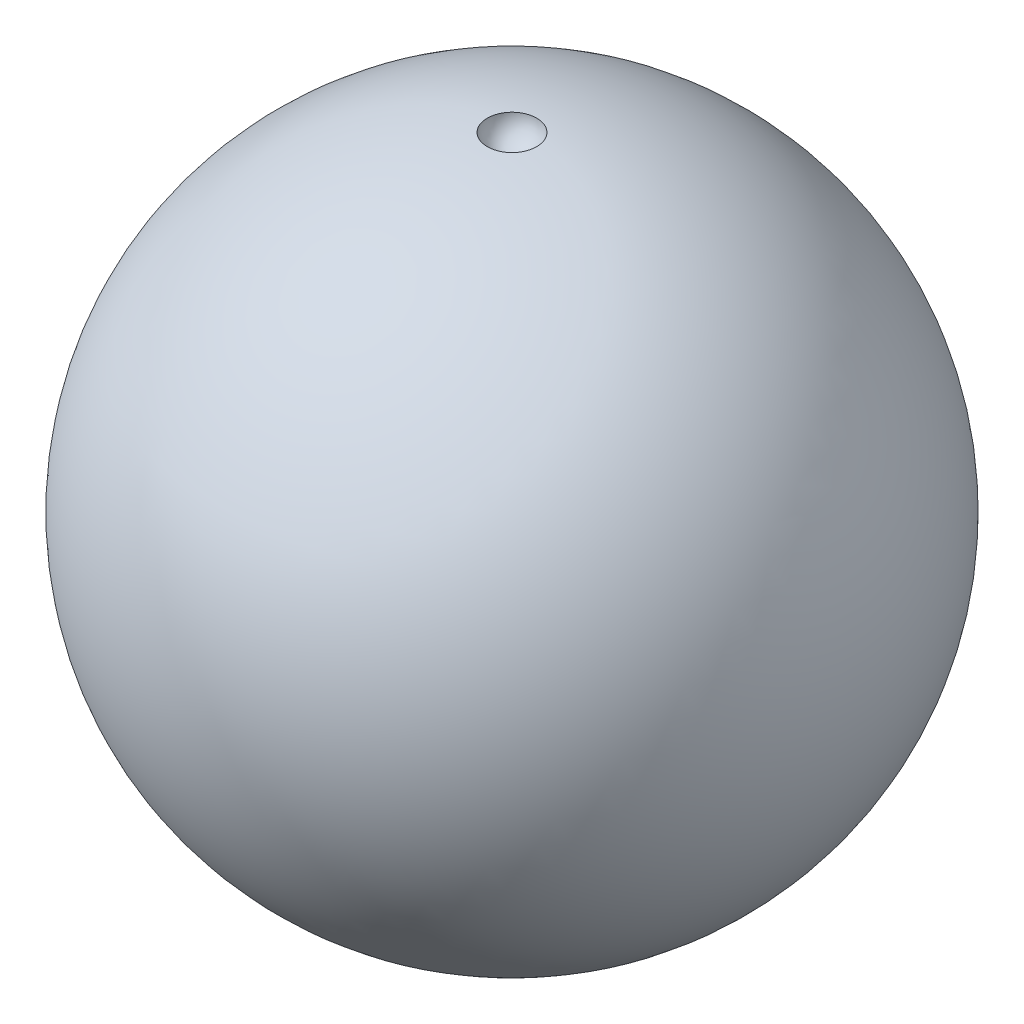
from build123d import *


with BuildPart() as part:
    # Sketch1 → Revolve1 (revolve)
    with BuildSketch(Plane.XY):
        with BuildLine():
            Line((0, 20), (0, 0))
            Line((0, 0), (20, 0))
            ThreePointArc((20, 0), (14.142135624, 14.142135624), (0, 20))
        make_face()
    revolve(axis=Axis((0, 20, 0), (0, -1, 0)))

    # Sketch3 → Cut-Revolve1 (revolve, cut)
    with BuildSketch(Plane.XY):
        with BuildLine():
            ThreePointArc((-1.5, 19.943670675), (-1.040935279, 18.919548309), (0, 18.5))
            Line((0, 18.5), (0, 20))
            ThreePointArc((0, 20), (-0.750528646, 19.985912707), (-1.5, 19.943670675))
        make_face()
    revolve(axis=Axis((0, 18.5, 0), (0, 1, 0)), mode=Mode.SUBTRACT)

    # Mirror1: part across plane


with BuildPart() as part_1:
    add(part.part)
    add(part.part.mirror(Plane.ZX))


solid = part_1.part
